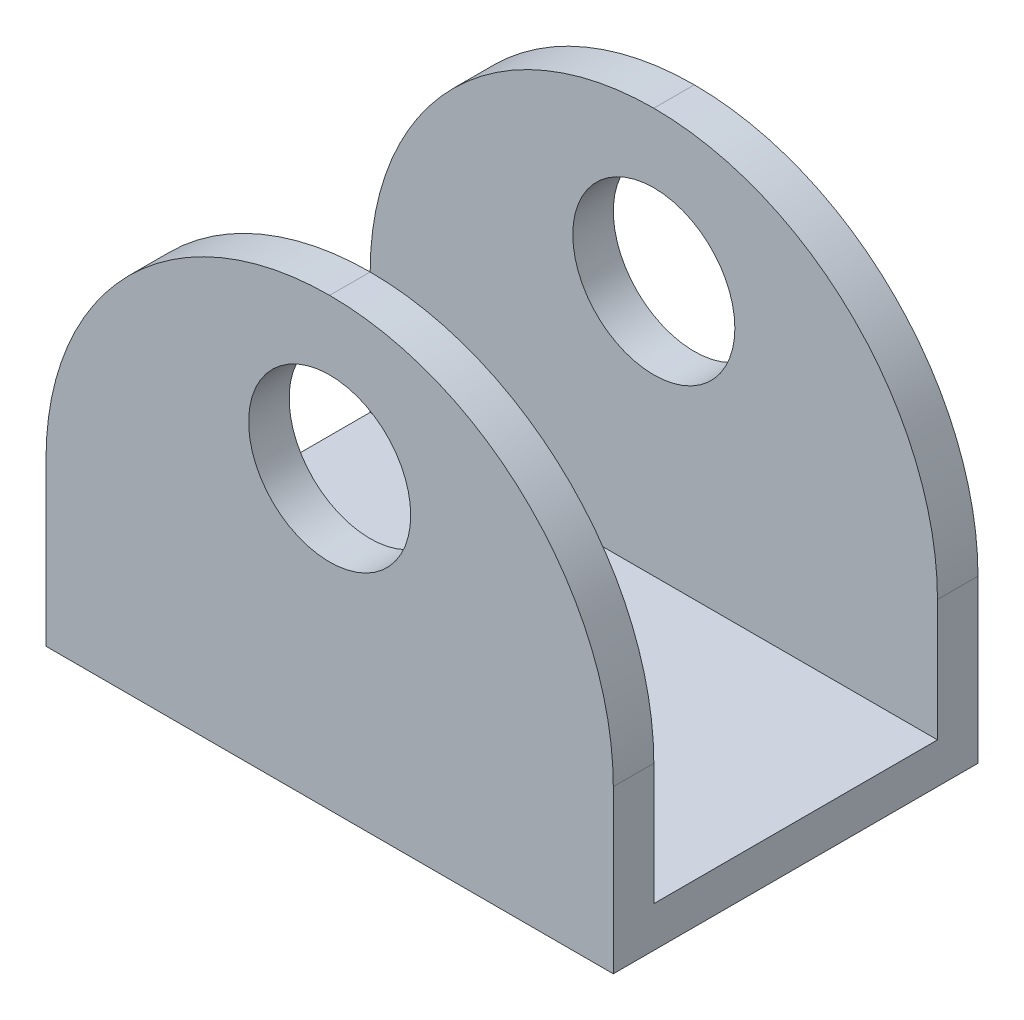
from build123d import *

# Parameters (mm, degrees)
CROQUIS1_W              = 140
CROQUIS1_H              = 90
SALIENTE_EXTRUIR1_DEPTH = 10
CROQUIS2_W              = 140
CROQUIS2_H              = 10
SALIENTE_EXTRUIR2_DEPTH = 100
REDONDEO1_R             = 70
CORTAR_EXTRUIR1_DEPTH   = 100


with BuildPart() as part:
    # Croquis1 → Saliente-Extruir1 (new body)
    with BuildSketch(Plane(origin=(0, 0, 0), x_dir=(1, 0, 0), z_dir=(0, 1, 0))):
        Rectangle(CROQUIS1_W, CROQUIS1_H)
    extrude(amount=SALIENTE_EXTRUIR1_DEPTH)

    # Croquis2 → Saliente-Extruir2 (add)
    with BuildSketch(Plane(origin=(0, 10, 0), x_dir=(1, 0, 0), z_dir=(0, 1, 0))):
        with Locations((0, -40)):
            Rectangle(CROQUIS2_W, CROQUIS2_H)
        with Locations((0, 40)):
            Rectangle(CROQUIS2_W, CROQUIS2_H)
    extrude(amount=SALIENTE_EXTRUIR2_DEPTH)

    # Redondeo1
    redondeo1_edges = [part.edges().sort_by_distance(p)[0] for p in [
        (-70, 110, 40),
        (70, 110, 40),
        (70, 110, -40),
        (-70, 110, -40),
    ]]
    fillet(redondeo1_edges, radius=REDONDEO1_R - 0.0001)  # a hair under: the kernel refuses the full size

    # Croquis3 → Cortar-Extruir1 (cut)
    with BuildSketch(Plane.XY.offset(45)):
        with BuildLine():
            ThreePointArc((0, 93), (-20, 73), (0, 53))
            Line((0, 53), (0, 73))
            Line((0, 73), (0, 93))
        make_face()
        with BuildLine():
            Line((0, 73), (0, 53))
            ThreePointArc((0, 53), (14.142135624, 58.857864376), (20, 73))
            ThreePointArc((20, 73), (14.142135624, 87.142135624), (0, 93))
            Line((0, 93), (0, 73))
        make_face()
    extrude(amount=-CORTAR_EXTRUIR1_DEPTH, mode=Mode.SUBTRACT)


solid = part.part
